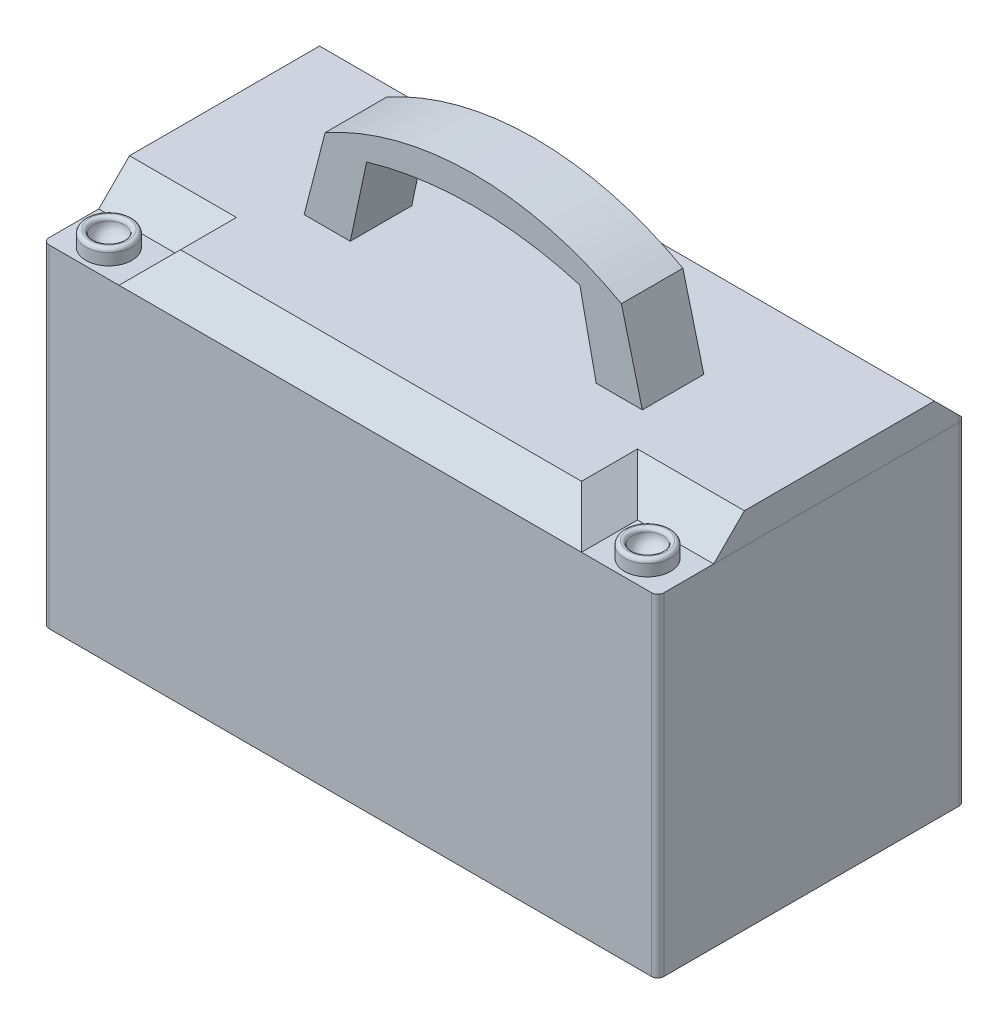
from build123d import *

# Parameters (mm, degrees)
SKETCH1_W            = 254
SKETCH1_H            = 127
BOSS_EXTRUDE1_DEPTH  = 150
SKETCH2_W            = 31.483174514
SKETCH2_H            = 23.106740065
CUT_EXTRUDE1_DEPTH   = 12.7
SKETCH3_R            = 9.525
SKETCH3_R_2          = 6.35
BOSS_EXTRUDE2_DEPTH  = 6.35
FILLET1_R            = 1.5875
FILLET1_OF_MIRROR1_R = 1.5875
CHAMFER1_SIZE        = 12.7
FILLET2_R            = 5.08
FILLET3_R            = 2.54
BOSS_EXTRUDE3_START  = -50.8
BOSS_EXTRUDE3_DEPTH  = 25.4


with BuildPart() as part:
    # Sketch1 → Boss-Extrude1 (new body)
    with BuildSketch(Plane(origin=(0, 0, 0), x_dir=(1, 0, 0), z_dir=(0, 1, 0))):
        with Locations((127, 63.5)):
            Rectangle(SKETCH1_W, SKETCH1_H)
    extrude(amount=BOSS_EXTRUDE1_DEPTH)

    # Sketch2 → Cut-Extrude1 (cut)
    with BuildSketch(Plane(origin=(0, 150, 0), x_dir=(1, 0, 0), z_dir=(0, 1, 0))):
        with Locations((15.741587257, 11.553370033)):
            Rectangle(SKETCH2_W, SKETCH2_H)
    cut_extrude1 = extrude(amount=-CUT_EXTRUDE1_DEPTH, mode=Mode.SUBTRACT)

    # Sketch3 → Boss-Extrude2 (add)
    with BuildSketch(Plane(origin=(0, 137.3, 0), x_dir=(1, 0, 0), z_dir=(0, 1, 0))):
        with Locations(Location((15.741587257, 11.553370033, 0), (0, 0, 270))):
            Circle(SKETCH3_R)
        with Locations(Location((15.741587257, 11.553370033, 0), (0, 0, 270))):
            Circle(SKETCH3_R_2, mode=Mode.SUBTRACT)
    boss_extrude2 = extrude(amount=BOSS_EXTRUDE2_DEPTH)

    # Fillet1
    fillet1_edges = [part.edges().sort_by_distance(p)[0] for p in [
        (15.741587257, 143.65, -21.078370033),
        (15.741587257, 143.65, -17.903370033),
    ]]
    fillet(fillet1_edges, radius=FILLET1_R - 0.0001)  # a hair under: the kernel refuses the full size

    # Mirror1: Cut-Extrude1, Boss-Extrude2 across plane
    add(cut_extrude1.mirror(Plane(origin=(127, 0, 0), x_dir=(0, 0, 1), z_dir=(1, 0, 0))), mode=Mode.SUBTRACT)
    add(boss_extrude2.mirror(Plane(origin=(127, 0, 0), x_dir=(0, 0, 1), z_dir=(1, 0, 0))))

    # Fillet1 of Mirror1
    fillet1_of_mirror1_edges = [part.edges().sort_by_distance(p)[0] for p in [
        (238.258412743, 143.65, -21.078370033),
        (238.258412743, 143.65, -17.903370033),
    ]]
    fillet(fillet1_of_mirror1_edges, radius=FILLET1_OF_MIRROR1_R - 0.0001)  # a hair under: the kernel refuses the full size

    # Chamfer1
    chamfer1_edges = [part.edges().sort_by_distance(p)[0] for p in [
        (31.483174514, 150, -11.553370033),
        (15.741587257, 150, -23.106740065),
        (127, 150, -127),
        (238.258412743, 150, -23.106740065),
        (222.516825486, 150, -11.553370033),
        (127, 150, 0),
    ]]
    chamfer(chamfer1_edges, length=CHAMFER1_SIZE - 0.0001)  # a hair under: the kernel refuses the full size

    # Fillet2
    fillet2_edges = [part.edges().sort_by_distance(p)[0] for p in [
        (238.258412743, 137.3, -17.903370033),
        (15.741587257, 137.3, -17.903370033),
    ]]
    fillet(fillet2_edges, radius=FILLET2_R)

    # Fillet3
    fillet3_edges = [part.edges().sort_by_distance(p)[0] for p in [
        (0, 68.65, 0),
        (254, 68.65, 0),
        (0, 68.65005, -127),
        (254, 68.65005, -127),
    ]]
    fillet(fillet3_edges, radius=FILLET3_R)

    # Sketch4 → Boss-Extrude3 (add)
    with BuildSketch(Plane.XY.offset(BOSS_EXTRUDE3_START)):
        with BuildLine():
            Line((177.8, 150), (196.85, 150))
            Line((196.85, 150), (188.196329167, 183.655))
            ThreePointArc((188.196329167, 183.655), (127, 199.53), (65.803670833, 183.655))
            Line((65.803670833, 183.655), (57.15, 150))
            Line((57.15, 150), (76.2, 150))
            Line((76.2, 150), (82.948670833, 181.75))
            ThreePointArc((82.948670833, 181.75), (127, 188.1), (171.051329167, 181.75))
            Line((171.051329167, 181.75), (177.8, 150))
        make_face()
    extrude(amount=-BOSS_EXTRUDE3_DEPTH)


solid = part.part
